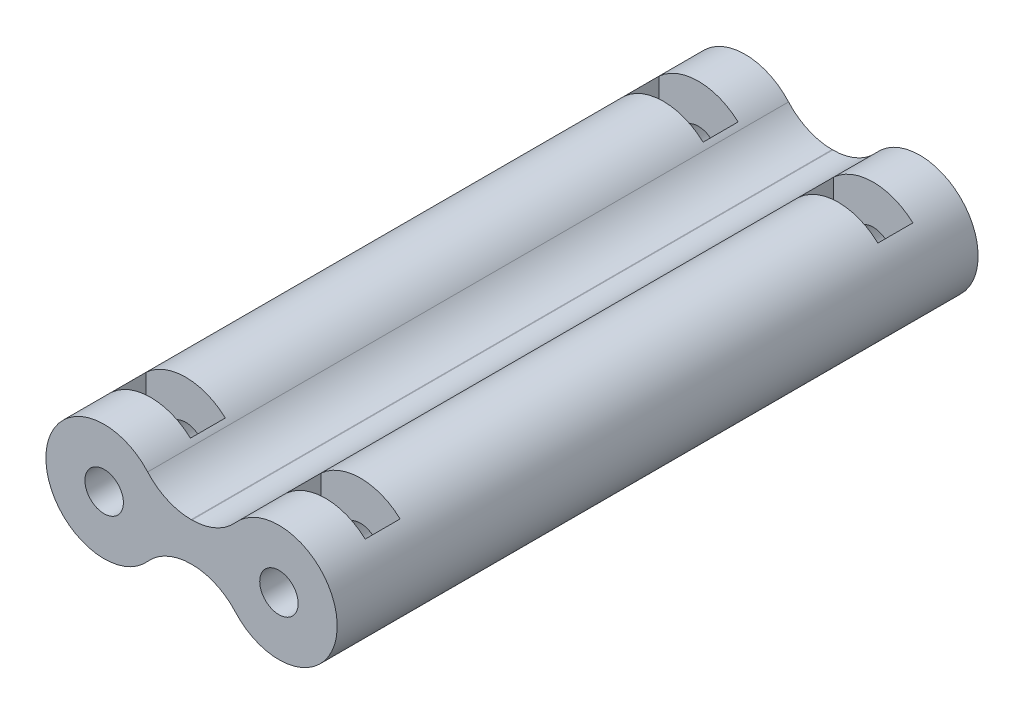
from build123d import *

# Parameters (mm, degrees)
ESBO_O1_R                  = 1.65
RESSALTO_EXTRUS_O1_DEPTH   = 55
FILETE1_R                  = 5
CORTE_EXTRUS_O1_DEPTH      = 57.623758265
CORTE_EXTRUS_O1_DEPTH_BACK = 57.623758265
ESBO_O2_W                  = 6.8
ESBO_O2_H                  = 3


with BuildPart() as part:
    # Esboço1 → Ressalto-extrusão1 (new body)
    with BuildSketch(Plane.XY):
        with BuildLine():
            Line((-2.78009534, 1.65), (2.78009534, 1.65))
            ThreePointArc((2.78009534, 1.65), (12.5, 0), (2.78009534, -1.65))
            Line((2.78009534, -1.65), (-2.78009534, -1.65))
            ThreePointArc((-2.78009534, -1.65), (-12.5, 0), (-2.78009534, 1.65))
        make_face()
        with Locations((-7.5, 0)):
            Circle(ESBO_O1_R, mode=Mode.SUBTRACT)
        with Locations((7.5, 0)):
            Circle(ESBO_O1_R, mode=Mode.SUBTRACT)
    extrude(amount=RESSALTO_EXTRUS_O1_DEPTH)

    # Filete1
    filete1_edges = [part.edges().sort_by_distance(p)[0] for p in [
        (-2.78009534, -1.65, 27.5),
        (2.78009534, -1.65, 27.5),
        (2.78009534, 1.65, 27.5),
        (-2.78009534, 1.65, 27.5),
    ]]
    fillet(filete1_edges, radius=FILETE1_R)

    # Esboço2 → Corte-extrusão1 (cut, two sides: drawn at the far end of the back side and taken through both)
    with BuildSketch(Plane(origin=(0, 0, 0), x_dir=(1, 0, 0), z_dir=(0, 1, 0)).offset(-CORTE_EXTRUS_O1_DEPTH_BACK)):
        with Locations((-7.5, -5.5)):
            Rectangle(ESBO_O2_W, ESBO_O2_H)
        with Locations((7.5, -5.5)):
            Rectangle(ESBO_O2_W, ESBO_O2_H)
        with Locations((7.5, -49.5)):
            Rectangle(ESBO_O2_W, ESBO_O2_H)
        with Locations((-7.5, -49.5)):
            Rectangle(ESBO_O2_W, ESBO_O2_H)
    extrude(amount=CORTE_EXTRUS_O1_DEPTH + CORTE_EXTRUS_O1_DEPTH_BACK, mode=Mode.SUBTRACT)


solid = part.part
